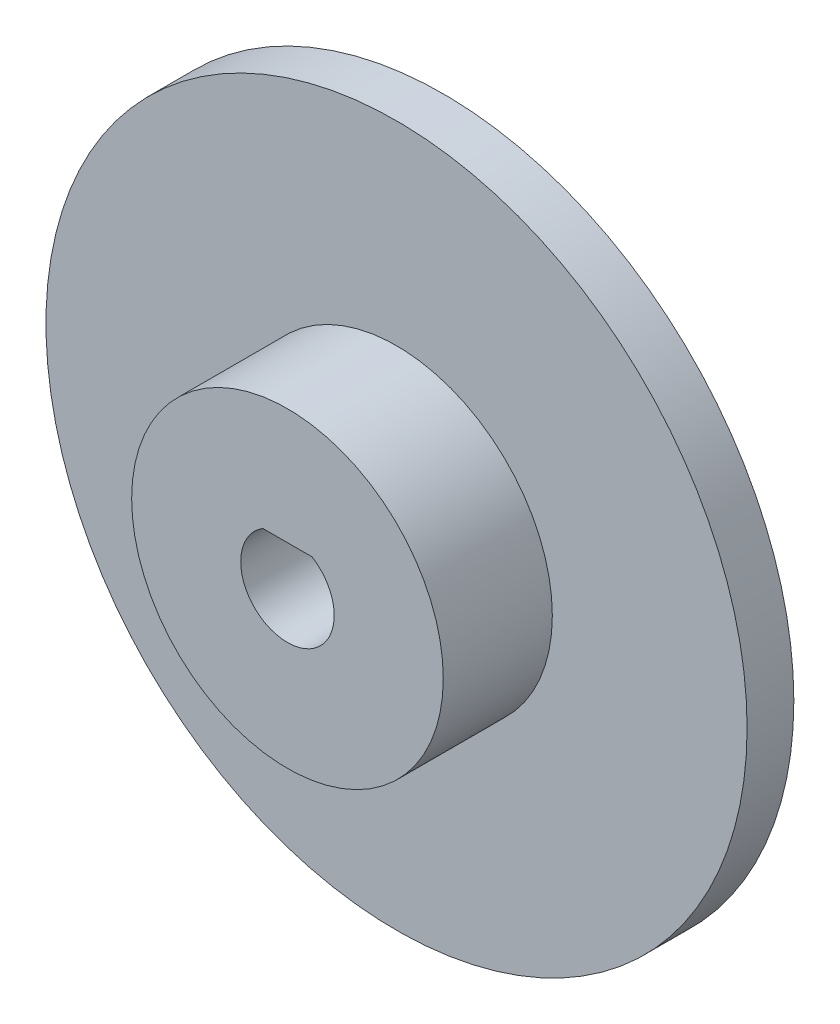
from build123d import *

# Parameters (mm, degrees)
SKETCH1_R           = 22.5
BOSS_EXTRUDE1_DEPTH = 3
SKETCH1_3_R         = 10
BOSS_EXTRUDE2_DEPTH = 10


with BuildPart() as part:
    # Sketch1 → Boss-Extrude1 (new body)
    with BuildSketch(Plane.XY):
        Circle(SKETCH1_R)
        with BuildLine():
            Line((-1.580348063, 2.55), (1.580348063, 2.55))
            ThreePointArc((1.580348063, 2.55), (0, -3), (-1.580348063, 2.55))
        make_face(mode=Mode.SUBTRACT)
    extrude(amount=BOSS_EXTRUDE1_DEPTH)

    # Sketch1<3> → Boss-Extrude2 (add)
    with BuildSketch(Plane.XY):
        Circle(SKETCH1_3_R)
        with BuildLine():
            Line((-1.580348063, 2.55), (1.580348063, 2.55))
            ThreePointArc((1.580348063, 2.55), (0, -3), (-1.580348063, 2.55))
        make_face(mode=Mode.SUBTRACT)
    extrude(amount=BOSS_EXTRUDE2_DEPTH)


solid = part.part
